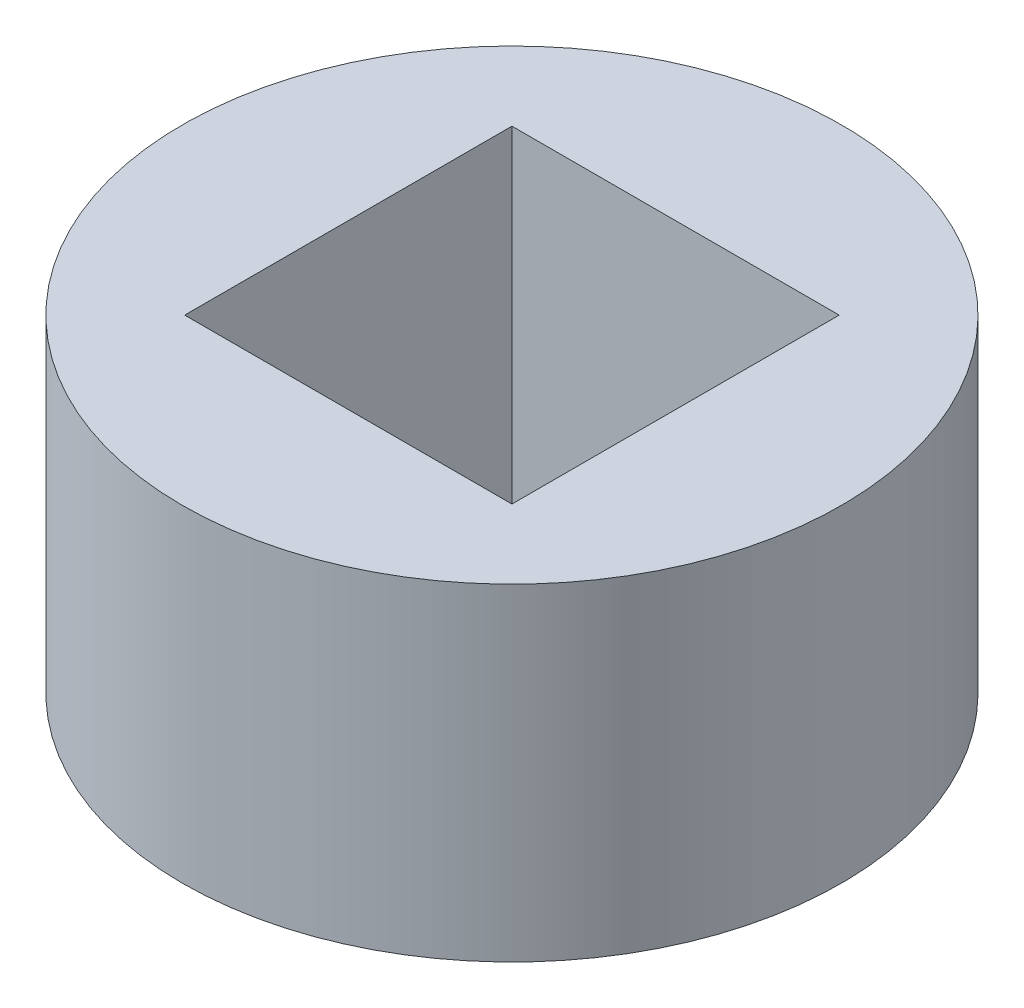
from build123d import *

# Parameters (mm, degrees)
ELEVATOR_AXLE_BEARING_R = 6.395128061
ELEVATOR_AXLE_BEARING_W = 6.35
ELEVATOR_AXLE_BEARING_H = 6.35
BOSS_EXTRUDE1_DEPTH     = 6.35


with BuildPart() as part:
    # Elevator Axle Bearing → Boss-Extrude1 (new body)
    with BuildSketch(Plane(origin=(0, 0, 0), x_dir=(1, 0, 0), z_dir=(0, 1, 0))):
        Circle(ELEVATOR_AXLE_BEARING_R)
        Rectangle(ELEVATOR_AXLE_BEARING_W, ELEVATOR_AXLE_BEARING_H, mode=Mode.SUBTRACT)
    extrude(amount=BOSS_EXTRUDE1_DEPTH)


solid = part.part
